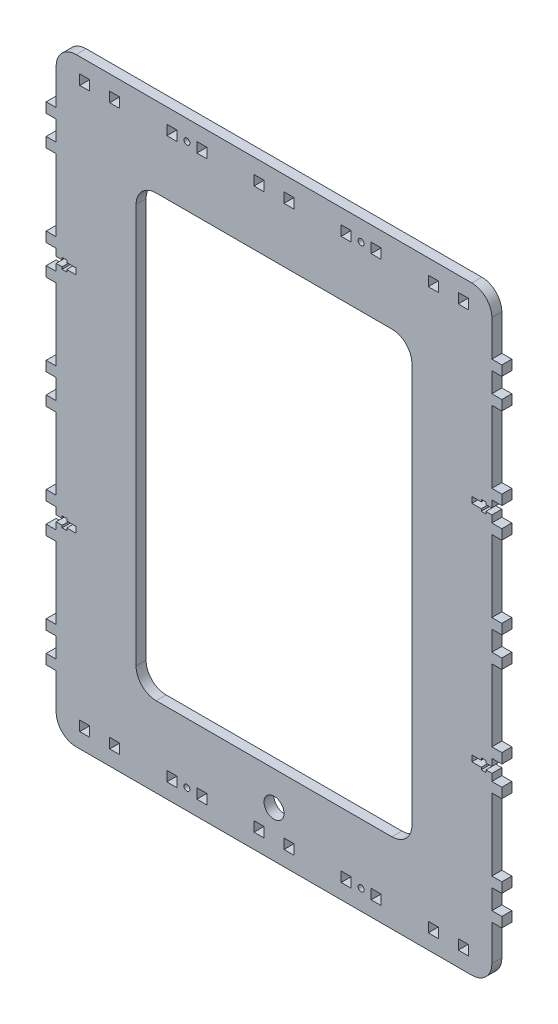
from build123d import *

# Parameters (mm, degrees)
SKETCH1_W           = 5
SKETCH1_H           = 5
SKETCH1_R           = 1.5
SKETCH1_R_2         = 5
BOSS_EXTRUDE5_DEPTH = 5


with BuildPart() as part:
    # Sketch1 → Boss-Extrude5 (new body)
    with BuildSketch(Plane.XY):
        with BuildLine():
            Line((109, 122), (109, 140))
            ThreePointArc((109, 140), (106.071067812, 147.071067812), (99, 150))
            Line((99, 150), (-99, 150))
            ThreePointArc((-99, 150), (-106.071067812, 147.071067812), (-109, 140))
            Line((-109, 140), (-109, 122))
            Line((-109, 122), (-114, 122))
            Line((-114, 122), (-114, 117))
            Line((-114, 117), (-109, 117))
            Line((-109, 117), (-109, 113.5))
            Line((-109, 113.5), (-109, 110.5))
            Line((-109, 110.5), (-109, 107))
            Line((-109, 107), (-114, 107))
            Line((-114, 107), (-114, 102))
            Line((-114, 102), (-109, 102))
            Line((-109, 102), (-109, 66))
            Line((-109, 66), (-114, 66))
            Line((-114, 66), (-114, 61))
            Line((-114, 61), (-109, 61))
            Line((-109, 61), (-109, 57.5))
            Line((-109, 57.5), (-106, 57.5))
            Line((-106, 57.5), (-106, 58.6))
            Line((-106, 58.6), (-103.7, 58.6))
            Line((-103.7, 58.6), (-103.7, 57.5))
            Line((-103.7, 57.5), (-99, 57.5))
            Line((-99, 57.5), (-99, 54.5))
            Line((-99, 54.5), (-103.7, 54.5))
            Line((-103.7, 54.5), (-103.7, 53.4))
            Line((-103.7, 53.4), (-106, 53.4))
            Line((-106, 53.4), (-106, 54.5))
            Line((-106, 54.5), (-109, 54.5))
            Line((-109, 54.5), (-109, 51))
            Line((-109, 51), (-114, 51))
            Line((-114, 51), (-114, 46))
            Line((-114, 46), (-109, 46))
            Line((-109, 46), (-109, 10))
            Line((-109, 10), (-114, 10))
            Line((-114, 10), (-114, 5))
            Line((-114, 5), (-109, 5))
            Line((-109, 5), (-109, 1.5))
            Line((-109, 1.5), (-109, -1.5))
            Line((-109, -1.5), (-109, -5))
            Line((-109, -5), (-114, -5))
            Line((-114, -5), (-114, -10))
            Line((-114, -10), (-109, -10))
            Line((-109, -10), (-109, -46))
            Line((-109, -46), (-114, -46))
            Line((-114, -46), (-114, -51))
            Line((-114, -51), (-109, -51))
            Line((-109, -51), (-109, -54.5))
            Line((-109, -54.5), (-106, -54.5))
            Line((-106, -54.5), (-106, -53.4))
            Line((-106, -53.4), (-103.7, -53.4))
            Line((-103.7, -53.4), (-103.7, -54.5))
            Line((-103.7, -54.5), (-99, -54.5))
            Line((-99, -54.5), (-99, -57.5))
            Line((-99, -57.5), (-103.7, -57.5))
            Line((-103.7, -57.5), (-103.7, -58.6))
            Line((-103.7, -58.6), (-106, -58.6))
            Line((-106, -58.6), (-106, -57.5))
            Line((-106, -57.5), (-109, -57.5))
            Line((-109, -57.5), (-109, -61))
            Line((-109, -61), (-114, -61))
            Line((-114, -61), (-114, -66))
            Line((-114, -66), (-109, -66))
            Line((-109, -66), (-109, -102))
            Line((-109, -102), (-114, -102))
            Line((-114, -102), (-114, -107))
            Line((-114, -107), (-109, -107))
            Line((-109, -107), (-109, -108.00000182))
            Line((-109, -108.00000182), (-109, -110.5))
            Line((-109, -110.5), (-109, -113.5))
            Line((-109, -113.5), (-109, -117))
            Line((-109, -117), (-114, -117))
            Line((-114, -117), (-114, -122))
            Line((-114, -122), (-109, -122))
            Line((-109, -122), (-109, -140))
            ThreePointArc((-109, -140), (-106.071067812, -147.071067812), (-99, -150))
            Line((-99, -150), (99, -150))
            ThreePointArc((99, -150), (106.071067812, -147.071067812), (109, -140))
            Line((109, -140), (109, -122))
            Line((109, -122), (114, -122))
            Line((114, -122), (114, -117))
            Line((114, -117), (109, -117))
            Line((109, -117), (109, -113.5))
            Line((109, -113.5), (109, -110.5))
            Line((109, -110.5), (109, -107))
            Line((109, -107), (114, -107))
            Line((114, -107), (114, -102))
            Line((114, -102), (109, -102))
            Line((109, -102), (109, -66))
            Line((109, -66), (114, -66))
            Line((114, -66), (114, -61))
            Line((114, -61), (109, -61))
            Line((109, -61), (109, -57.5))
            Line((109, -57.5), (106, -57.5))
            Line((106, -57.5), (106, -58.6))
            Line((106, -58.6), (103.7, -58.6))
            Line((103.7, -58.6), (103.7, -57.5))
            Line((103.7, -57.5), (99, -57.5))
            Line((99, -57.5), (99, -54.5))
            Line((99, -54.5), (103.7, -54.5))
            Line((103.7, -54.5), (103.7, -53.4))
            Line((103.7, -53.4), (106, -53.4))
            Line((106, -53.4), (106, -54.5))
            Line((106, -54.5), (109, -54.5))
            Line((109, -54.5), (109, -51))
            Line((109, -51), (114, -51))
            Line((114, -51), (114, -46))
            Line((114, -46), (109, -46))
            Line((109, -46), (109, -10))
            Line((109, -10), (114, -10))
            Line((114, -10), (114, -5))
            Line((114, -5), (109, -5))
            Line((109, -5), (109, -1.5))
            Line((109, -1.5), (109, 1.5))
            Line((109, 1.5), (109, 5))
            Line((109, 5), (114, 5))
            Line((114, 5), (114, 10))
            Line((114, 10), (109, 10))
            Line((109, 10), (109, 46))
            Line((109, 46), (114, 46))
            Line((114, 46), (114, 51))
            Line((114, 51), (109, 51))
            Line((109, 51), (109, 54.5))
            Line((109, 54.5), (106, 54.5))
            Line((106, 54.5), (106, 53.4))
            Line((106, 53.4), (103.7, 53.4))
            Line((103.7, 53.4), (103.7, 54.5))
            Line((103.7, 54.5), (99, 54.5))
            Line((99, 54.5), (99, 57.5))
            Line((99, 57.5), (103.7, 57.5))
            Line((103.7, 57.5), (103.7, 58.6))
            Line((103.7, 58.6), (106, 58.6))
            Line((106, 58.6), (106, 57.5))
            Line((106, 57.5), (109, 57.5))
            Line((109, 57.5), (109, 61))
            Line((109, 61), (114, 61))
            Line((114, 61), (114, 66))
            Line((114, 66), (109, 66))
            Line((109, 66), (109, 102))
            Line((109, 102), (114, 102))
            Line((114, 102), (114, 107))
            Line((114, 107), (109, 107))
            Line((109, 107), (109, 110.5))
            Line((109, 110.5), (109, 113.5))
            Line((109, 113.5), (109, 117))
            Line((109, 117), (114, 117))
            Line((114, 117), (114, 122))
            Line((114, 122), (109, 122))
        make_face()
        with Locations((-94.7, -140)):
            Rectangle(SKETCH1_W, SKETCH1_H, mode=Mode.SUBTRACT)
        with Locations((-79.7, -140)):
            Rectangle(SKETCH1_W, SKETCH1_H, mode=Mode.SUBTRACT)
        with Locations((-51.1, -140)):
            Rectangle(SKETCH1_W, SKETCH1_H, mode=Mode.SUBTRACT)
        with Locations((-43.6, -140)):
            Circle(SKETCH1_R, mode=Mode.SUBTRACT)
        with Locations((-36.1, -140)):
            Rectangle(SKETCH1_W, SKETCH1_H, mode=Mode.SUBTRACT)
        with Locations((-7.5, -140)):
            Rectangle(SKETCH1_W, SKETCH1_H, mode=Mode.SUBTRACT)
        with Locations((7.5, -140)):
            Rectangle(SKETCH1_W, SKETCH1_H, mode=Mode.SUBTRACT)
        with Locations((0, -126.874914365)):
            Circle(SKETCH1_R_2, mode=Mode.SUBTRACT)
        with Locations((36.1, -140)):
            Rectangle(SKETCH1_W, SKETCH1_H, mode=Mode.SUBTRACT)
        with Locations((43.6, -140)):
            Circle(SKETCH1_R, mode=Mode.SUBTRACT)
        with Locations((51.1, -140)):
            Rectangle(SKETCH1_W, SKETCH1_H, mode=Mode.SUBTRACT)
        with Locations((79.7, -140)):
            Rectangle(SKETCH1_W, SKETCH1_H, mode=Mode.SUBTRACT)
        with Locations((94.7, -140)):
            Rectangle(SKETCH1_W, SKETCH1_H, mode=Mode.SUBTRACT)
        with BuildLine():
            ThreePointArc((69, -100), (66.071067812, -107.071067812), (59, -110))
            Line((59, -110), (-59, -110))
            ThreePointArc((-59, -110), (-66.071067812, -107.071067812), (-69, -100))
            Line((-69, -100), (-69, 100))
            ThreePointArc((-69, 100), (-66.071067812, 107.071067812), (-59, 110))
            Line((-59, 110), (59, 110))
            ThreePointArc((59, 110), (66.071067812, 107.071067812), (69, 100))
            Line((69, 100), (69, -100))
        make_face(mode=Mode.SUBTRACT)
        with Locations((-94.7, 140)):
            Rectangle(SKETCH1_W, SKETCH1_H, mode=Mode.SUBTRACT)
        with Locations((-79.7, 140)):
            Rectangle(SKETCH1_W, SKETCH1_H, mode=Mode.SUBTRACT)
        with Locations((-51.1, 140)):
            Rectangle(SKETCH1_W, SKETCH1_H, mode=Mode.SUBTRACT)
        with Locations((-43.6, 140)):
            Circle(SKETCH1_R, mode=Mode.SUBTRACT)
        with Locations((-36.1, 140)):
            Rectangle(SKETCH1_W, SKETCH1_H, mode=Mode.SUBTRACT)
        with Locations((-7.5, 140)):
            Rectangle(SKETCH1_W, SKETCH1_H, mode=Mode.SUBTRACT)
        with Locations((7.5, 140)):
            Rectangle(SKETCH1_W, SKETCH1_H, mode=Mode.SUBTRACT)
        with Locations((36.1, 140)):
            Rectangle(SKETCH1_W, SKETCH1_H, mode=Mode.SUBTRACT)
        with Locations((43.6, 140)):
            Circle(SKETCH1_R, mode=Mode.SUBTRACT)
        with Locations((51.1, 140)):
            Rectangle(SKETCH1_W, SKETCH1_H, mode=Mode.SUBTRACT)
        with Locations((79.7, 140)):
            Rectangle(SKETCH1_W, SKETCH1_H, mode=Mode.SUBTRACT)
        with Locations((94.7, 140)):
            Rectangle(SKETCH1_W, SKETCH1_H, mode=Mode.SUBTRACT)
    extrude(amount=BOSS_EXTRUDE5_DEPTH)


solid = part.part
